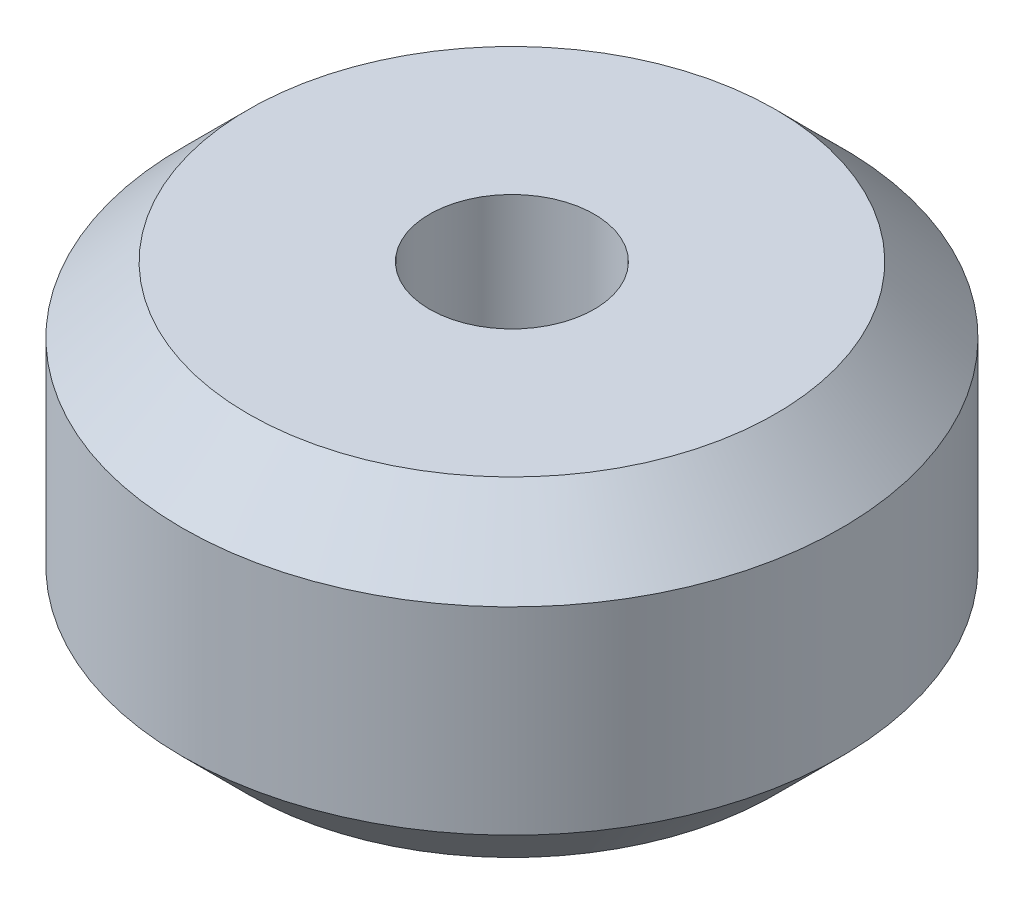
from build123d import *


with BuildPart() as part:
    # Sketch1 → Revolve1 (revolve)
    with BuildSketch(Plane.XY):
        Polygon((-8, -5), (-2.5, -5), (-2.5, 5), (-8, 5), (-10, 3), (-10, -3), align=None)
    revolve(axis=Axis((0, 23.892278862, 0), (0, -1, 0)))


solid = part.part
